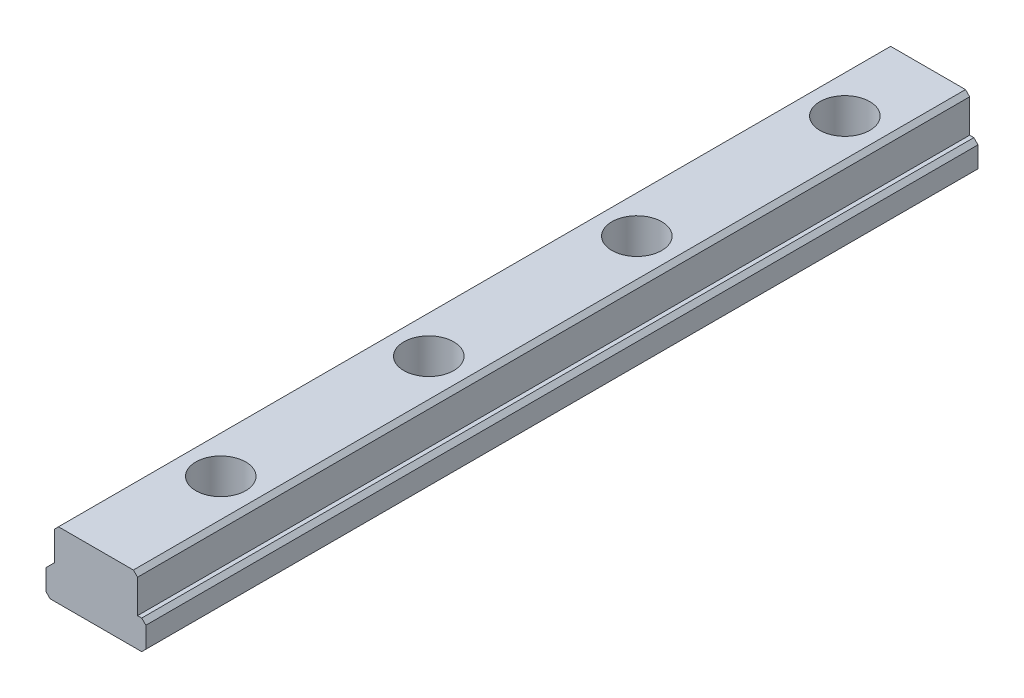
from build123d import *

# Parameters (mm, degrees)
SKETCH_1_W          = 12
SKETCH_1_H          = 8
EXTRUDE_1_DEPTH     = 100
SKETCH_2_W          = 1
SKETCH_2_H          = 4.5
CUT_EXTRUDE_1_DEPTH = 400
CHAMFER_1_SIZE      = 0.5
SKETCH_3_R          = 1.75
CUT_EXTRUDE_2_DEPTH = 400
SKETCH_4_R          = 3
CUT_EXTRUDE_3_DEPTH = 4.5


with BuildPart() as part:
    # 草图1 → 凸台-拉伸1 (new body)
    with BuildSketch(Plane.XY):
        Rectangle(SKETCH_1_W, SKETCH_1_H)
    extrude(amount=EXTRUDE_1_DEPTH)

    # 草图2 → 切除-拉伸1 (cut)
    with BuildSketch(Plane.XY.offset(100)):
        with Locations((-5.5, 1.75)):
            Rectangle(SKETCH_2_W, SKETCH_2_H)
        with Locations((5.5, 1.75)):
            Rectangle(SKETCH_2_W, SKETCH_2_H)
    extrude(amount=-CUT_EXTRUDE_1_DEPTH, mode=Mode.SUBTRACT)

    # 倒角1
    chamfer_1_edges = [part.edges().sort_by_distance(p)[0] for p in [
        (-5, 4, 50),
        (-5, -0.5, 50),
        (-6, -0.5, 50),
        (6, -0.5, 50),
        (5, 4, 50),
        (6, -4, 50),
        (-6, -4, 50),
    ]]
    chamfer(chamfer_1_edges, length=CHAMFER_1_SIZE - 0.0001)  # a hair under: the kernel refuses the full size

    # 草图3 → 切除-拉伸2 (cut)
    with BuildSketch(Plane(origin=(0, 4, 0), x_dir=(1, 0, 0), z_dir=(0, 1, 0))):
        with Locations(Location((0, -10, 0), (0, 0, 180))):
            Circle(SKETCH_3_R)
        with Locations(Location((0, -35, 0), (0, 0, 180))):
            Circle(SKETCH_3_R)
        with Locations(Location((0, -60, 0), (0, 0, 180))):
            Circle(SKETCH_3_R)
        with Locations(Location((0, -85, 0), (0, 0, 180))):
            Circle(SKETCH_3_R)
        with Locations((0, -110)):
            Circle(SKETCH_3_R)
        with Locations((0, -135)):
            Circle(SKETCH_3_R)
        with Locations((0, -160)):
            Circle(SKETCH_3_R)
        with Locations((0, -185)):
            Circle(SKETCH_3_R)
        with Locations((0, -210)):
            Circle(SKETCH_3_R)
        with Locations((0, -235)):
            Circle(SKETCH_3_R)
        with Locations((0, -260)):
            Circle(SKETCH_3_R)
        with Locations((0, -285)):
            Circle(SKETCH_3_R)
        with Locations((0, -310)):
            Circle(SKETCH_3_R)
        with Locations((0, -335)):
            Circle(SKETCH_3_R)
        with Locations((0, -360)):
            Circle(SKETCH_3_R)
        with Locations((0, -385)):
            Circle(SKETCH_3_R)
    extrude(amount=-CUT_EXTRUDE_2_DEPTH, mode=Mode.SUBTRACT)

    # 草图4 → 切除-拉伸3 (cut)
    with BuildSketch(Plane(origin=(0, 4, 0), x_dir=(1, 0, 0), z_dir=(0, 1, 0))):
        with Locations(Location((0, -10, 0), (0, 0, 180))):
            Circle(SKETCH_4_R)
        with Locations(Location((0, -35, 0), (0, 0, 180))):
            Circle(SKETCH_4_R)
        with Locations(Location((0, -60, 0), (0, 0, 180))):
            Circle(SKETCH_4_R)
        with Locations(Location((0, -85, 0), (0, 0, 180))):
            Circle(SKETCH_4_R)
        with Locations((0, -110)):
            Circle(SKETCH_4_R)
        with Locations((0, -135)):
            Circle(SKETCH_4_R)
        with Locations((0, -160)):
            Circle(SKETCH_4_R)
        with Locations((0, -185)):
            Circle(SKETCH_4_R)
        with Locations((0, -210)):
            Circle(SKETCH_4_R)
        with Locations((0, -235)):
            Circle(SKETCH_4_R)
        with Locations((0, -260)):
            Circle(SKETCH_4_R)
        with Locations((0, -285)):
            Circle(SKETCH_4_R)
        with Locations((0, -310)):
            Circle(SKETCH_4_R)
        with Locations((0, -335)):
            Circle(SKETCH_4_R)
        with Locations((0, -360)):
            Circle(SKETCH_4_R)
        with Locations((0, -385)):
            Circle(SKETCH_4_R)
    extrude(amount=-CUT_EXTRUDE_3_DEPTH, mode=Mode.SUBTRACT)


solid = part.part
